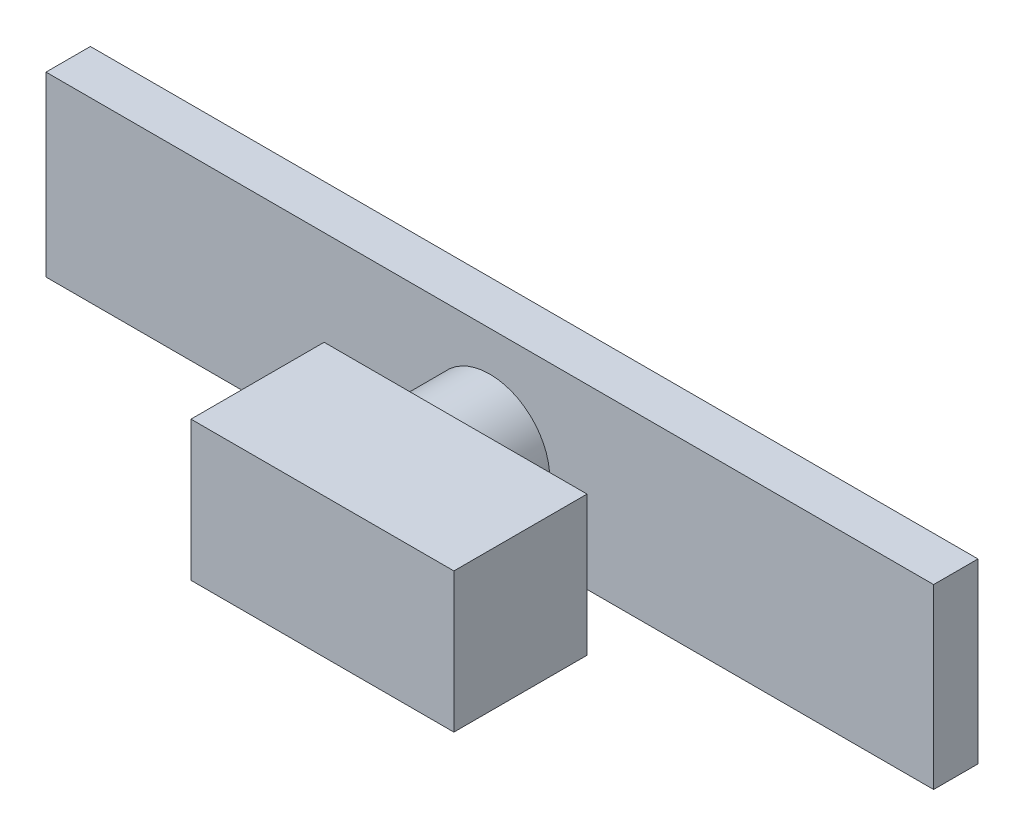
from build123d import *

# Parameters (mm, degrees)
SKETCH2_W           = 254
SKETCH2_H           = 12.7
BOSS_EXTRUDE1_DEPTH = 50.8
SKETCH3_R           = 17.140791438
BOSS_EXTRUDE2_DEPTH = 19.05
SKETCH4_W           = 75.235944222
SKETCH4_H           = 39.955088207
BOSS_EXTRUDE3_DEPTH = 38.1
SCALE2_SCALE        = 0.06
ROTATE_ANGLE        = 90
SCALE5_SCALE        = 0.25
SCALE6_SCALE        = 0.25


with BuildPart() as part:
    # Sketch2 → Boss-Extrude1 (new body)
    with BuildSketch(Plane.XY):
        with Locations((79.130769231, 14.898076923)):
            Rectangle(SKETCH2_W, SKETCH2_H)
    extrude(amount=BOSS_EXTRUDE1_DEPTH)

    # Sketch3 → Boss-Extrude2 (add)
    with BuildSketch(Plane(origin=(0, 21.248076923, 0), x_dir=(1, 0, 0), z_dir=(0, 1, 0))):
        with Locations((79.130769231, -28.483063876)):
            Circle(SKETCH3_R)
    extrude(amount=BOSS_EXTRUDE2_DEPTH)

    # Sketch4 → Boss-Extrude3 (add)
    with BuildSketch(Plane(origin=(0, 40.298076923, 0), x_dir=(1, 0, 0), z_dir=(0, 1, 0))):
        with Locations((88.38546847, -28.088530296)):
            Rectangle(SKETCH4_W, SKETCH4_H)
    extrude(amount=BOSS_EXTRUDE3_DEPTH)


with BuildPart() as part_1:
    # Scale2: scaled about (82.711857342, 33.041003565, 26.623476887)
    add(part.part.scale(SCALE2_SCALE).moved(Location((77.749145901, 31.058543351, 25.026068274))))


with BuildPart() as part_2:
    # rotate: moved
    add(part_1.part.rotate(Axis((0, 33.666927966, 26.550068274), (1, 0, 0)), ROTATE_ANGLE))


with BuildPart() as part_3:
    # Scale5: scaled about (82.711857342, 33.593519353, 25.924143873)
    add(part_2.part.scale(SCALE5_SCALE).moved(Location((62.033893007, 25.195139515, 19.443107905))))


with BuildPart() as part_4:
    # Move Body 4 x: moved
    add(part_3.part.moved(Location((-101.6, 0, 0))))


with BuildPart() as part_5:
    # Move Body 2 y: moved
    add(part_4.part.moved(Location((0, -50.8, 0))))


with BuildPart() as part_6:
    # Scale6: scaled about (-18.888142658, -17.206480647, 25.924143873)
    add(part_5.part.scale(SCALE6_SCALE).moved(Location((-14.166106993, -12.904860485, 19.443107905))))


with BuildPart() as part_7:
    # Move Body 2.1z: moved
    add(part_6.part.moved(Location((0, 0, -38.1))))


solid = part_7.part
